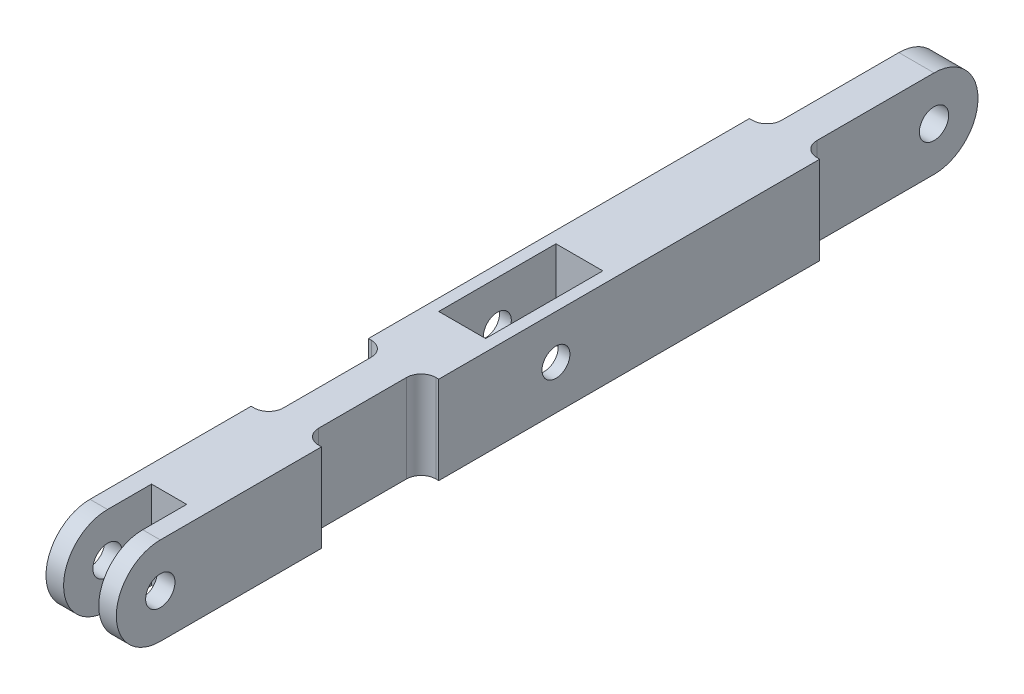
from build123d import *

# Parameters (mm, degrees)
SKETCH1_R           = 2.5
SKETCH1_R_2         = 2.38125
BASE_DEPTH          = 6
ALL_CUTS_DEPTH      = 76.612498967
ALL_CUTS_DEPTH_BACK = 76.612498967
SKETCH2_W           = 6
SKETCH2_H           = 30
SKETCH2_H_2         = 20
SKETCH2_W_2         = 8
FILLET1_R           = 2.5


with BuildPart() as part:
    # Sketch1 → BASE (new, symmetric)
    with BuildSketch(Plane(origin=(0, 0, 0), x_dir=(0, 0, -1), z_dir=(1, 0, 0))):
        with BuildLine():
            Line((-67.5, 7.5), (67.5, 7.5))
            ThreePointArc((67.5, 7.5), (75, 0), (67.5, -7.5))
            Line((67.5, -7.5), (-67.5, -7.5))
            ThreePointArc((-67.5, -7.5), (-75, 0), (-67.5, 7.5))
        make_face()
        with Locations((-67.5, 0)):
            Circle(SKETCH1_R, mode=Mode.SUBTRACT)
        Circle(SKETCH1_R_2, mode=Mode.SUBTRACT)
        with Locations((67.5, 0)):
            Circle(SKETCH1_R, mode=Mode.SUBTRACT)
    extrude(amount=BASE_DEPTH, both=True)

    # Sketch2 → All_Cuts (cut, two sides: drawn at the far end of the back side and taken through both)
    with BuildSketch(Plane(origin=(0, 0, 0), x_dir=(1, 0, 0), z_dir=(0, 1, 0)).offset(-ALL_CUTS_DEPTH_BACK)):
        with Locations((0, -75)):
            Rectangle(SKETCH2_W, SKETCH2_H)
        with Locations((-6, -30)):
            Rectangle(SKETCH2_W, SKETCH2_H_2)
        with Locations((6, -30)):
            Rectangle(SKETCH2_W, SKETCH2_H_2)
        with Locations((6, 60)):
            Rectangle(SKETCH2_W, SKETCH2_H)
        with Locations((-6, 60)):
            Rectangle(SKETCH2_W, SKETCH2_H)
        Rectangle(SKETCH2_W_2, SKETCH2_H_2)
    extrude(amount=ALL_CUTS_DEPTH + ALL_CUTS_DEPTH_BACK, mode=Mode.SUBTRACT)

    # Fillet1
    fillet1_edges = [part.edges().sort_by_distance(p)[0] for p in [
        (3, 0, -45),
        (3, 0, 40),
        (3, 0, 20),
        (-3, 0, 40),
        (-3, 0, 20),
        (-3, 0, -45),
    ]]
    fillet(fillet1_edges, radius=FILLET1_R)


solid = part.part
